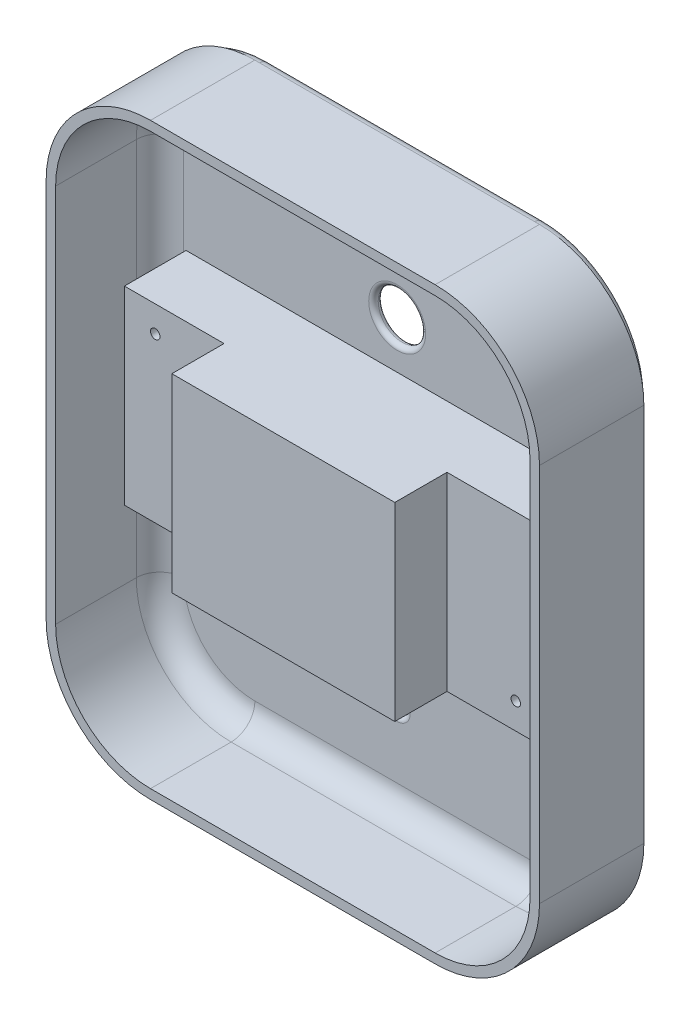
from build123d import *

# Parameters (mm, degrees)
BOSS_EXTRUDE1_DEPTH = 22
SKETCH3_W           = 47
SKETCH3_H           = 40
BOSS_EXTRUDE2_DEPTH = 24
SKETCH7_W           = 89
SKETCH7_H           = 40
SKETCH7_R           = 1
BOSS_EXTRUDE4_DEPTH = 13
SKETCH6_R           = 1.75
SKETCH6_R_2         = 5
BOSS_EXTRUDE3_DEPTH = 2
FILLET10_R          = 5
FILLET12_R          = 2
FILLET13_R          = 1
FILLET14_R          = 1


with BuildPart() as part:
    # Sketch1 → Boss-Extrude1 (new body)
    with BuildSketch(Plane.XY):
        with BuildLine():
            Line((-30, 62), (30, 62))
            ThreePointArc((30, 62), (45.556349186, 55.556349186), (52, 40))
            Line((52, 40), (52, -40))
            ThreePointArc((52, -40), (45.556349186, -55.556349186), (30, -62))
            Line((30, -62), (-30, -62))
            ThreePointArc((-30, -62), (-45.556349186, -55.556349186), (-52, -40))
            Line((-52, -40), (-52, 40))
            ThreePointArc((-52, 40), (-45.556349186, 55.556349186), (-30, 62))
        make_face()
        with BuildLine():
            Line((-30, 60), (30, 60))
            ThreePointArc((30, 60), (44.142135624, 54.142135624), (50, 40))
            Line((50, 40), (50, -40))
            ThreePointArc((50, -40), (44.142135624, -54.142135624), (30, -60))
            Line((30, -60), (-30, -60))
            ThreePointArc((-30, -60), (-44.142135624, -54.142135624), (-50, -40))
            Line((-50, -40), (-50, 40))
            ThreePointArc((-50, 40), (-44.142135624, 54.142135624), (-30, 60))
        make_face(mode=Mode.SUBTRACT)
    extrude(amount=BOSS_EXTRUDE1_DEPTH)


with BuildPart() as body_2:
    # Sketch3 → Boss-Extrude2 (new body)
    with BuildSketch(Plane.XY):
        Rectangle(SKETCH3_W, SKETCH3_H)
    extrude(amount=BOSS_EXTRUDE2_DEPTH)


with BuildPart() as body_3:
    # Sketch7 → Boss-Extrude4 (new body)
    with BuildSketch(Plane(origin=(0, 0, 0), x_dir=(-1, 0, 0), z_dir=(0, 0, -1))):
        Rectangle(SKETCH7_W, SKETCH7_H)
        with Locations((-38, -14.5)):
            Circle(SKETCH7_R, mode=Mode.SUBTRACT)
        with Locations((38, 14.5)):
            Circle(SKETCH7_R, mode=Mode.SUBTRACT)
    extrude(amount=-BOSS_EXTRUDE4_DEPTH)

    # Combine2: union body 2
    add(body_2.part)


with BuildPart() as body_4:
    # Sketch6 → Boss-Extrude3 (new body)
    with BuildSketch(Plane.XY):
        with BuildLine():
            Line((-29, 62), (29, 62))
            ThreePointArc((29, 62), (44.556349186, 55.556349186), (51, 40))
            Line((51, 40), (51, -40))
            ThreePointArc((51, -40), (44.556349186, -55.556349186), (29, -62))
            Line((29, -62), (-29, -62))
            ThreePointArc((-29, -62), (-44.556349186, -55.556349186), (-51, -40))
            Line((-51, -40), (-51, 40))
            ThreePointArc((-51, 40), (-44.556349186, 55.556349186), (-29, 62))
        make_face()
        with Locations((0, 41)):
            Circle(SKETCH6_R, mode=Mode.SUBTRACT)
        with Locations((0, -41)):
            Circle(SKETCH6_R, mode=Mode.SUBTRACT)
        with Locations((0, 30)):
            Circle(SKETCH6_R_2, mode=Mode.SUBTRACT)
        with Locations((0, -30)):
            Circle(SKETCH6_R_2, mode=Mode.SUBTRACT)
    extrude(amount=-BOSS_EXTRUDE3_DEPTH)


with BuildPart() as part_1:
    add(part.part)

    # Combine1: union body 4
    add(body_4.part)

    # Fillet10
    fillet10_edges = [part_1.edges().sort_by_distance(p)[0] for p in [
        (44.142135624, 54.142135624, 0),
        (0, 60, 0),
        (-44.142135624, 54.142135624, 0),
        (-50, 0, 0),
        (-44.142135624, -54.142135624, 0),
        (0, -60, 0),
        (44.142135624, -54.142135624, 0),
        (50, 0, 0),
    ]]
    fillet(fillet10_edges, radius=FILLET10_R)

    # Fillet12
    fillet12_edges = [part_1.edges().sort_by_distance(p)[0] for p in [
        (-44.556349186, -55.556349186, -2),
        (0, -62, -2),
        (44.556349186, -55.556349186, -2),
        (51, 0, -2),
        (44.556349186, 55.556349186, -2),
        (0, 62, -2),
        (-51, 0, -2),
        (-44.556349186, 55.556349186, -2),
    ]]
    fillet(fillet12_edges, radius=FILLET12_R - 0.0001)  # a hair under: the kernel refuses the full size

    # Fillet13
    fillet13_edges = [part_1.edges().sort_by_distance(p)[0] for p in [
        (-5, 30, -2),
        (-5, 30, 0),
    ]]
    fillet(fillet13_edges, radius=FILLET13_R - 0.0001)  # a hair under: the kernel refuses the full size

    # Fillet14
    fillet14_edges = [part_1.edges().sort_by_distance(p)[0] for p in [
        (-5, -30, -2),
        (-1.75, -41, -2),
        (-1.75, 41, -2),
        (-1.75, 41, 0),
        (-1.75, -41, 0),
        (-5, -30, 0),
    ]]
    fillet(fillet14_edges, radius=FILLET14_R - 0.0001)  # a hair under: the kernel refuses the full size


solid = Compound([body_3.part, part_1.part])
